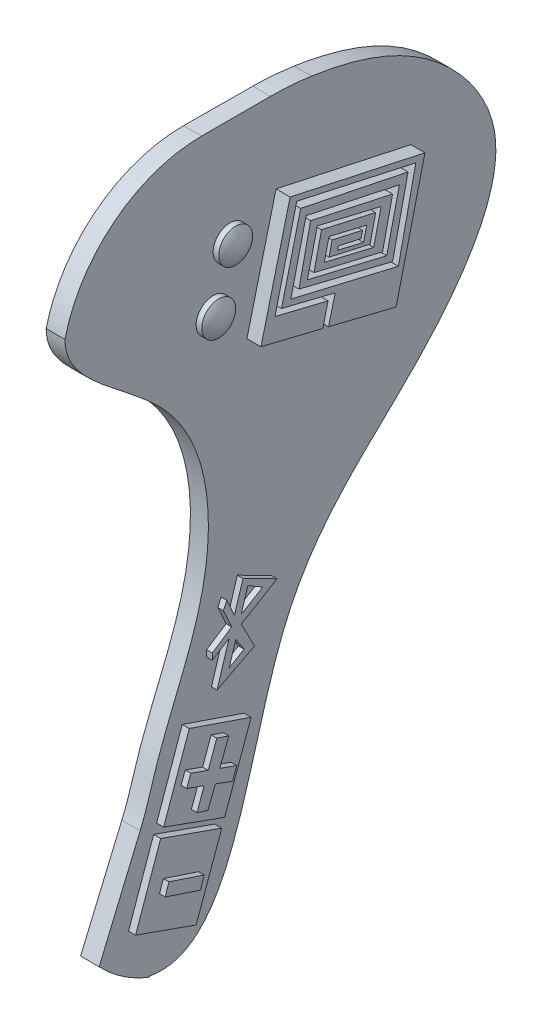
from build123d import *

# Parameters (mm, degrees)
BOSS_EXTRUDE1_DEPTH = 4
CUT_EXTRUDE3_START  = -10
CUT_EXTRUDE3_DEPTH  = 10
CUT_EXTRUDE4_DEPTH  = 10
FILLET4_START       = -1
FILLET4_DEPTH       = 6
SKETCH7_RX          = 1.83432271
SKETCH7_RY          = 1.648181576
BOSS_EXTRUDE2_DEPTH = 3
SKETCH8_R           = 1.941403724
BOSS_EXTRUDE3_DEPTH = 0.5
DOME1_FACE_RADIUS   = 1.941403724
DOME1_HEIGHT        = 5
CUT_EXTRUDE5_DEPTH  = 5
CUT_EXTRUDE7_DEPTH  = 50
BOSS_EXTRUDE4_DEPTH = 0.5
CUT_EXTRUDE8_DEPTH  = 2
BOSS_EXTRUDE5_DEPTH = 0.25
BOSS_EXTRUDE6_DEPTH = 0.2
SKETCH16_R          = 0.603233744
SKETCH16_R_2        = 0.604088712
BOSS_EXTRUDE7_DEPTH = 0.2
DOME2_FACE_RADIUS   = 0.604088712
DOME2_HEIGHT        = 0.2
BOSS_EXTRUDE8_DEPTH = 0.2


with BuildPart() as part:
    # Sketch1 → Boss-Extrude1 (new body)
    with BuildSketch(Plane(origin=(0, 0, 0), x_dir=(0, 0, -1), z_dir=(1, 0, 0))):
        with BuildLine():
            Line((6.442518848, 0), (13.409619329, 0))
            ThreePointArc((13.409619329, 0), (16.945153235, -1.464466094), (18.409619329, -5))
            Line((18.409619329, -5), (18.409619329, -20.34540211))
            ThreePointArc((18.409619329, -20.34540211), (16.945153235, -23.880936016), (13.409619329, -25.34540211))
            Line((13.409619329, -25.34540211), (6.442518848, -25.34540211))
            ThreePointArc((6.442518848, -25.34540211), (2.906984942, -23.880936016), (1.442518848, -20.34540211))
            Line((1.442518848, -20.34540211), (1.442518848, -5))
            ThreePointArc((1.442518848, -5), (2.906984942, -1.464466094), (6.442518848, 0))
        make_face()
    extrude(amount=BOSS_EXTRUDE1_DEPTH)

    # Sketch2 → Cut-Extrude3 (cut)
    with BuildSketch(Plane(origin=(4, 0, 0), x_dir=(0, 0, -1), z_dir=(1, 0, 0)).offset(CUT_EXTRUDE3_START)):
        with BuildLine():
            add(Edge.make_bspline(
                [(2.42884403, -23.286077848), (2.370716158, -22.573896831), (4.185530255, -21.12926271), (4.874517164, -17.962112227), (7.118988975, -13.802662727), (6.544049448, -7.530329658), (1.569055746, -5.349803368), (1.58046752, -3.833613753)],
                knots=[0.531334438, 0.531334438, 0.531334438, 0.531334438, 0.570400737, 0.608236932, 0.680812242, 0.778589658, 0.857107486, 0.857107486, 0.857107486, 0.857107486], degree=3))
            ThreePointArc((1.58046752, -3.833613753), (1.47712578, -4.412742239), (1.442518848, -5))
            Line((1.442518848, -5), (1.442518848, -20.34540211))
            ThreePointArc((1.442518848, -20.34540211), (1.683757797, -21.87974016), (2.384196149, -23.266021372))
            add(Edge.make_bspline(
                [(2.384196149, -23.266021372), (2.399070873, -23.272759012), (2.413953527, -23.279444568), (2.428844038, -23.286077844)],
                knots=[0.998981394, 0.998981394, 0.998981394, 0.998981394, 0.999513034, 0.999513034, 0.999513034, 0.999513034], degree=3))
        make_face()
        with BuildLine():
            Line((13.409619329, 0), (9.46398266, 0))
            add(Edge.make_bspline(
                [(9.46398266, 0), (11.207503001, -0.168664697), (14.40943711, -0.885845558), (18.093070912, -5.600973008), (14.034927819, -11.50687924), (8.23474836, -15.211494887), (7.662204752, -25.591568315), (4.542739971, -24.937885151)],
                knots=[0, 0, 0, 0, 0.077946221, 0.143334379, 0.228662798, 0.345497184, 0.490655992, 0.490655992, 0.490655992, 0.490655992], degree=3))
            add(Edge.make_bspline(
                [(4.54273997, -24.937885153), (5.749127141, -25.532851997), (7.208451258, -25.09277451), (8.521498661, -25.334156754), (8.57622256, -25.34540211)],
                knots=[0.001400322, 0.001400322, 0.001400322, 0.001400322, 0.038459748, 0.040079073, 0.040079073, 0.040079073, 0.040079073], degree=3))
            Line((8.57622256, -25.34540211), (13.409619329, -25.34540211))
            ThreePointArc((13.409619329, -25.34540211), (16.945153235, -23.880936016), (18.409619329, -20.34540211))
            Line((18.409619329, -20.34540211), (18.409619329, -5))
            ThreePointArc((18.409619329, -5), (16.945153235, -1.464466094), (13.409619329, 0))
        make_face()
        with BuildLine():
            ThreePointArc((2.906984942, -1.464466094), (4.529101686, -0.380602337), (6.442518848, 0))
            add(Edge.make_bspline(
                [(6.442518848, 0), (7.443592251, 0.121124965), (8.454170968, 0.097687179), (9.46398266, 0)],
                knots=[0.954855127, 0.954855127, 0.954855127, 0.954855127, 1, 1, 1, 1], degree=3))
            Line((9.46398266, 0), (13.409619329, 0))
            ThreePointArc((13.409619329, 0), (16.945153235, -1.464466094), (18.409619329, -5))
            Line((18.409619329, -5), (18.409619329, -20.34540211))
            ThreePointArc((18.409619329, -20.34540211), (16.945153235, -23.880936016), (13.409619329, -25.34540211))
            Line((13.409619329, -25.34540211), (8.57622256, -25.34540211))
            add(Edge.make_bspline(
                [(8.57622256, -25.34540211), (10.509849295, -25.742748085), (21.004932545, -37.507061135), (40.108036136, 7.046689321), (11.067178354, 5.045725954), (-13.182357735, 4.105959789), (-4.736766595, -20.04051671), (2.384196149, -23.266021372)],
                knots=[0.040079073, 0.040079073, 0.040079073, 0.040079073, 0.09729665, 0.409886449, 0.593670055, 0.744469586, 0.998981394, 0.998981394, 0.998981394, 0.998981394], degree=3))
            ThreePointArc((2.384196149, -23.266021372), (1.683757797, -21.87974016), (1.442518848, -20.34540211))
            Line((1.442518848, -20.34540211), (1.442518848, -5))
            ThreePointArc((1.442518848, -5), (1.47712578, -4.412742239), (1.58046752, -3.833613753))
            add(Edge.make_bspline(
                [(1.58046752, -3.833613753), (1.586363874, -3.050213083), (2.186842654, -2.121305338), (2.906984942, -1.464466094)],
                knots=[0.857107486, 0.857107486, 0.857107486, 0.857107486, 0.897676897, 0.897676897, 0.897676897, 0.897676897], degree=3))
        make_face()
    extrude(amount=CUT_EXTRUDE3_DEPTH, mode=Mode.SUBTRACT)

    # Sketch6 → Cut-Extrude4 (cut)
    with BuildSketch(Plane(origin=(4, 0, 0), x_dir=(0, 0, -1), z_dir=(1, 0, 0))):
        with BuildLine():
            add(Edge.make_bspline(
                [(6.876629539, -24.646378986), (6.348652857, -24.697603605), (5.705170416, -25.181041107), (2.967179599, -24.643973727), (6.798679283, -26.524715176), (10.198220508, -25.437781208), (7.742791771, -24.562343399), (6.876629539, -24.646378986)],
                knots=[0, 0, 0, 0, 0.142115473, 0.262842986, 0.576183637, 0.76685513, 1, 1, 1, 1], degree=3))
        make_face()
    extrude(amount=-CUT_EXTRUDE4_DEPTH, mode=Mode.SUBTRACT)

    # Fillet4: read off the stored shape, not the designer's step
    # Fillet4 outline → Fillet4 (cut)
    with BuildSketch(Plane.YZ.offset(FILLET4_START)):
        with BuildLine():
            ThreePointArc((0, -8.890200058), (-0.027061887, -9.625390775), (-0.108101078, -10.356602363))
            add(Edge.make_bspline(
                [(0, -9.46398266), (-0.028832047, -9.762025236), (-0.064132076, -10.060000995), (-0.108101078, -10.356602363)],
                knots=[0, 0, 0, 0, 0.01332436, 0.01332436, 0.01332436, 0.01332436], degree=3))
            Line((0, -9.46398266), (0, -8.890200058))
        make_face()
    extrude(amount=FILLET4_DEPTH, mode=Mode.SUBTRACT)

    # Sketch7 → Boss-Extrude2 (add)
    with BuildSketch(Plane.ZY):
        with Locations(Location((-12.079238976, -5.176946967), (0, 0, 66.52385958))):
            Ellipse(SKETCH7_RX, SKETCH7_RY)
    extrude(amount=BOSS_EXTRUDE2_DEPTH)

    # Sketch8 → Boss-Extrude3 (add)
    with BuildSketch(Plane.ZY.offset(3)):
        with Locations((-12.079238976, -5.176946967)):
            Circle(SKETCH8_R)
    extrude(amount=BOSS_EXTRUDE3_DEPTH)

    # Dome1: a dome of height H over a round flat face of radius A is a cap of a sphere of radius (A * A + H * H) / (2 * H)
    dome1_r = (DOME1_FACE_RADIUS * DOME1_FACE_RADIUS + DOME1_HEIGHT * DOME1_HEIGHT) / (2 * DOME1_HEIGHT)
    dome1_base = Plane((-3.5, -5.176946967, -12.079238976), z_dir=(-1, 0, 0))
    with Locations(dome1_base.offset(DOME1_HEIGHT - dome1_r)):
        dome1_ball = Sphere(dome1_r, mode=Mode.PRIVATE)
    add(split(dome1_ball, bisect_by=dome1_base, keep=Keep.TOP, mode=Mode.PRIVATE))

    # Sketch9 → Cut-Extrude5 (cut)
    with BuildSketch(Plane.ZY):
        with BuildLine():
            Line((-4.325838527, -20.140987675), (-2.486204677, -24.505449301))
            add(Edge.make_bspline(
                [(-2.486204677, -24.505449301), (3.73593799, -24.171685926), (-2.121854058, -16.126748366), (-4.325838527, -20.140987675)],
                knots=[0, 0, 0, 0, 1, 1, 1, 1], degree=3))
        make_face()
    extrude(amount=-CUT_EXTRUDE5_DEPTH, mode=Mode.SUBTRACT)

    # Sketch10 → Cut-Extrude7 (cut)
    with BuildSketch(Plane(origin=(0, 0, 0), x_dir=(1, 0, 0), z_dir=(0, 1, 0))):
        with BuildLine():
            Line((3.445912049, 22.54484613), (2.960998661, -67.476637181))
            add(Edge.make_bspline(
                [(3.445912049, 22.54484613), (-13.855563218, 21.565901244), (-10.869739315, -19.96275103), (-6.005298993, -41.284030828), (-2.596819864, -71.855270225), (2.960998661, -67.476637181)],
                knots=[0, 0, 0, 0, 0.421996195, 0.847469743, 1, 1, 1, 1], degree=3))
        make_face()
    extrude(amount=-CUT_EXTRUDE7_DEPTH, mode=Mode.SUBTRACT)

    # Sketch12 → Boss-Extrude4 (add)
    with BuildSketch(Plane(origin=(4, 0, 0), x_dir=(0, 0, -1), z_dir=(1, 0, 0))):
        Polygon((9.089326436, -2.950873175), (13.885817301, -3.986259167), (12.860544362, -8.221384682), (8.053762402, -7.044638849), align=None)
    extrude(amount=BOSS_EXTRUDE4_DEPTH)

    # Sketch13 → Cut-Extrude8 (cut)
    with BuildSketch(Plane(origin=(4.5, 0, 0), x_dir=(0, 0, -1), z_dir=(1, 0, 0))):
        Polygon((10.252485044, -7.582907015), (10.457153382, -7.633011766), (10.692860911, -6.704279534), (8.784351003, -6.23230259), (9.464443564, -3.48903539), (13.285257079, -4.275782634), (12.735262986, -6.762445171), (9.404580001, -5.94614412), (9.816276085, -4.044669046), (12.735262986, -4.681231601), (12.377990274, -6.284565164), (9.940576532, -5.704982354), (10.207519124, -4.516700225), (12.133344328, -4.949328773), (11.936468866, -5.825710439), (10.750588661, -5.559307429), (10.474108097, -5.497197231), (10.58158808, -5.018755247), (11.667043661, -5.262598287), (11.614619627, -5.495961355), (10.805644611, -5.314228513), (10.780812532, -5.435848689), (11.700206827, -5.653556911), (11.812826766, -5.177956456), (10.472903622, -4.86066899), (10.304302693, -5.572680371), (12.061067747, -5.98867403), (12.328174007, -4.86066899), (10.057087383, -4.322886415), (9.705070517, -5.809473809), (12.527320819, -6.477769336), (12.97696912, -4.516700225), (9.659443936, -3.808592578), (9.116918916, -6.108797064), (12.943016764, -7.011218491), (13.561769561, -4.134142251), (9.326843721, -3.199937326), (8.552470532, -6.363103894), (10.440649888, -6.825348116), align=None)
    extrude(amount=-CUT_EXTRUDE8_DEPTH, mode=Mode.SUBTRACT)

    # Sketch14 → Boss-Extrude5 (add)
    with BuildSketch(Plane(origin=(4, 0, 0), x_dir=(0, 0, -1), z_dir=(1, 0, 0))):
        Polygon((5.753864582, -17.780305258), (7.954032098, -18.533193647), (7.010698546, -21.145493747), (4.841745667, -20.362258305), align=None)
        Polygon((5.996734742, -23.953384702), (3.842022047, -23.192195722), (4.736721587, -20.659552043), (6.909055467, -21.426966006), align=None)
    extrude(amount=BOSS_EXTRUDE5_DEPTH)

    # Sketch15 → Boss-Extrude6 (add)
    with BuildSketch(Plane(origin=(4.25, 0, 0), x_dir=(0, 0, -1), z_dir=(1, 0, 0))):
        Polygon((4.829866982, -21.9409246), (6.082610134, -22.35525193), (5.949628529, -22.757329665), (4.696885378, -22.343002335), align=None)
        Polygon((6.530200151, -18.367555233), (6.227528699, -19.204188885), (5.61186055, -18.985847046), (5.460117096, -19.382987199), (6.081514483, -19.607796181), (5.827716709, -20.309334951), (6.21510568, -20.437458452), (6.480590496, -19.752173795), (7.096113143, -19.974857416), (7.241852154, -19.563910676), (6.636671635, -19.349288192), (6.961846017, -18.509929397), align=None)
    extrude(amount=BOSS_EXTRUDE6_DEPTH)

    # Sketch16 → Boss-Extrude7 (add)
    with BuildSketch(Plane(origin=(4, 0, 0), x_dir=(0, 0, -1), z_dir=(1, 0, 0))):
        with Locations(Location((7.454795269, -3.781626891, 0), (0, 0, 180))):
            Circle(SKETCH16_R)
        with Locations(Location((6.851750692, -5.724460009, 0), (0, 0, 180))):
            Circle(SKETCH16_R_2)
    extrude(amount=BOSS_EXTRUDE7_DEPTH)

    # Dome2: a dome of height H over a round flat face of radius A is a cap of a sphere of radius (A * A + H * H) / (2 * H)
    dome2_r = (DOME2_FACE_RADIUS * DOME2_FACE_RADIUS + DOME2_HEIGHT * DOME2_HEIGHT) / (2 * DOME2_HEIGHT)
    dome2_base = Plane((4.2, -5.724460009, -6.851750692), z_dir=(1, 0, 0))
    with Locations(dome2_base.offset(DOME2_HEIGHT - dome2_r)):
        dome2_ball = Sphere(dome2_r, mode=Mode.PRIVATE)
    add(split(dome2_ball, bisect_by=dome2_base, keep=Keep.TOP, mode=Mode.PRIVATE))

    # Dome3: read off the stored shape, not the designer's step
    # Dome3 outline → Dome3 (revolve)
    with BuildSketch(Plane(origin=(0, -3.781626891, -7.454795269), x_dir=(0, 1, 0), z_dir=(0, 0, -1))):
        with BuildLine():
            Line((0, 4.2), (0.603233745, 4.199999999))
            ThreePointArc((0.603233745, 4.199999999), (0.317762078, 4.348696662), (0, 4.4))
            Line((0, 4.4), (0, 4.2))
        make_face()
    revolve(axis=Axis((0, -3.781626891, -7.454795269), (1, 0, 0)))

    # Sketch17 → Boss-Extrude8 (add)
    with BuildSketch(Plane(origin=(4, 0, 0), x_dir=(0, 0, -1), z_dir=(1, 0, 0))):
        Polygon((7.71427812, -14.162789657), (7.410515686, -15.143017717), (7.139699189, -14.550592122), (7.017804612, -14.808230212), (7.313685311, -15.455485094), (6.621482033, -15.912024365), (6.621482033, -16.135867791), (7.21846625, -15.76275283), (6.791807953, -17.139560453), (8.124245211, -16.44652063), (7.651458158, -15.537540998), (8.927709015, -14.779814307), align=None)
        Polygon((7.887851684, -14.471301982), (7.651458158, -15.23413353), (8.416675096, -14.779814307), align=None, mode=Mode.SUBTRACT)
        Polygon((7.458026582, -15.912024365), (7.221439137, -16.675481681), (7.753296245, -16.359711216), align=None, mode=Mode.SUBTRACT)
    extrude(amount=BOSS_EXTRUDE8_DEPTH)


solid = part.part
